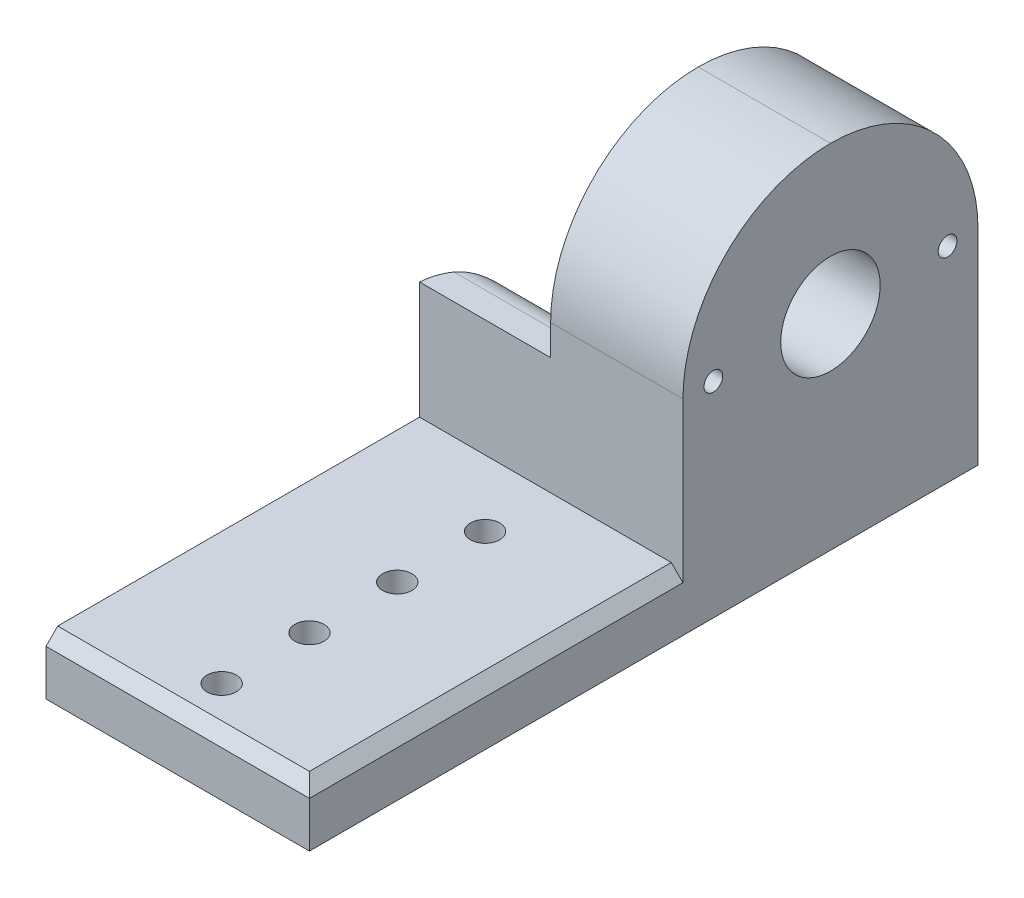
from build123d import *

# Parameters (mm, degrees)
SKETCH1_W           = 57.15
SKETCH1_H           = 145.034
BOSS_EXTRUDE1_DEPTH = 25.4
SKETCH4_R           = 3.175
CUT_EXTRUDE3_DEPTH  = 158.943482474
SKETCH7_W           = 28.702
SKETCH7_H           = 64.008
BOSS_EXTRUDE2_DEPTH = 76.454
FILLET1_R           = 32.004
SKETCH9_R           = 10.795
SKETCH9_R_2         = 2.032
CUT_EXTRUDE5_DEPTH  = 76.454
CUT_EXTRUDE7_DEPTH  = 12.954
CHAMFER1_SIZE       = 2.54
BOSS_EXTRUDE4_DEPTH = 28.448
FILLET3_R           = 6.35


# Some blends are built 0.0001 mm under size
with BuildPart() as part:
    # Sketch1 → Boss-Extrude1 (new body)
    with BuildSketch(Plane(origin=(0, 0, 0), x_dir=(1, 0, 0), z_dir=(0, 1, 0))):
        with Locations((28.575, 72.517)):
            Rectangle(SKETCH1_W, SKETCH1_H)
    extrude(amount=BOSS_EXTRUDE1_DEPTH)

    # Sketch4 → Cut-Extrude3 (cut, through all)
    with BuildSketch(Plane(origin=(0, 0, 0), x_dir=(-1, 0, 0), z_dir=(0, -1, 0))):
        with Locations(Location((-28.575, 9.525, 0), (0, 0, 90))):
            Circle(SKETCH4_R)
        with Locations(Location((-28.575, 28.575, 0), (0, 0, 90))):
            Circle(SKETCH4_R)
        with Locations(Location((-28.575, 47.625, 0), (0, 0, 90))):
            Circle(SKETCH4_R)
        with Locations(Location((-28.575, 66.675, 0), (0, 0, 90))):
            Circle(SKETCH4_R)
    extrude(amount=-CUT_EXTRUDE3_DEPTH, mode=Mode.SUBTRACT)

    # Sketch7 → Boss-Extrude2 (add)
    with BuildSketch(Plane.XZ):
        with Locations((42.799, -113.03)):
            Rectangle(SKETCH7_W, SKETCH7_H)
    extrude(amount=-BOSS_EXTRUDE2_DEPTH)

    # Fillet1
    fillet1_edges = [part.edges().sort_by_distance(p)[0] for p in [
        (42.799, 76.454, -145.034),
        (42.799, 76.454, -81.026),
    ]]
    fillet(fillet1_edges, radius=FILLET1_R - 0.0001)  # a hair under: the kernel refuses the full size

    # Sketch9 → Cut-Extrude5 (cut)
    with BuildSketch(Plane.ZY.offset(-28.448)):
        with Locations((-113.03, 44.45)):
            Circle(SKETCH9_R)
        with Locations((-138.43, 44.45)):
            Circle(SKETCH9_R_2)
        with Locations((-87.63, 44.45)):
            Circle(SKETCH9_R_2)
    extrude(amount=-CUT_EXTRUDE5_DEPTH, mode=Mode.SUBTRACT)

    # Sketch10 → Cut-Extrude7 (cut)
    with BuildSketch(Plane(origin=(0, 25.4, 0), x_dir=(1, 0, 0), z_dir=(0, 1, 0))):
        Polygon((28.448, 113.03), (28.448, 81.026), (57.15, 81.026), (57.15, 0), (50.8, 0), (0, 0), (0, 113.03), (0, 145.034), (28.448, 145.034), align=None)
    extrude(amount=-CUT_EXTRUDE7_DEPTH, mode=Mode.SUBTRACT)

    # Chamfer1
    chamfer1_edges = [part.edges().sort_by_distance(p)[0] for p in [
        (57.15, 12.446, -40.513),
        (28.575, 12.446, 0),
    ]]
    chamfer(chamfer1_edges, length=CHAMFER1_SIZE)

    # Sketch14 → Boss-Extrude4 (add)
    with BuildSketch(Plane.ZY.offset(-28.448)):
        Polygon((-113.637411412, 13.462), (-138.021411412, 37.846), (-145.034, 37.846), (-145.034, 12.446), (-81.026, 12.446), (-81.026, 37.846), (-89.253411412, 37.846), align=None)
    extrude(amount=BOSS_EXTRUDE4_DEPTH)

    # Fillet3
    # the kernel refuses this fillet: 6.35 mm, written as the material it takes off along each edge
    with BuildSketch(Plane(origin=(0, 49.071320151, -78.028091261), x_dir=(1, 0, 0), z_dir=(0, -0.707106781186549, -0.7071067811865461)), Plane(origin=(0, 13.462, -113.637411412), x_dir=(1, 0, 0), z_dir=(0, 0.7071067811865438, -0.7071067811865512))) as fillet3_piece_1:
        with BuildLine():
            CenterArc((FILLET3_R, FILLET3_R), FILLET3_R, 180, 90)
            Line((0, FILLET3_R), (0, 0))
            Line((0, 0), (FILLET3_R, 0))
        make_face()
    extrude(amount=50.359183505, mode=Mode.SUBTRACT)
    with BuildSketch(Plane(origin=(28.448, 37.846, -89.253411412), x_dir=(0, -0.7071067811865475, -0.7071067811865475), z_dir=(-1, 0, 0)), Plane(origin=(28.448, 37.846, -138.021411412), x_dir=(0, 0, -1), z_dir=(-1, 0, 0))) as fillet3_piece_2:
        with BuildLine():
            CenterArc((FILLET3_R * 0.414213562373, FILLET3_R), FILLET3_R, 225, 45)
            Line((-FILLET3_R * 0.292893218813, FILLET3_R * 0.292893218813), (0, 0))
            Line((0, 0), (FILLET3_R * 0.414213562373, 0))
        make_face()
    extrude(amount=35.023640303, mode=Mode.SUBTRACT)
    with BuildSketch(Plane(origin=(0, 2.236679849, -102.412091261), x_dir=(1, 0, 0), z_dir=(0, 0.7071067811865438, -0.7071067811865512))) as fillet3_piece_3a_section:
        with BuildLine():
            CenterArc((FILLET3_R, FILLET3_R), FILLET3_R, 180, 90)
            Line((0, FILLET3_R), (0, 0))
            Line((0, 0), (FILLET3_R, 0))
        make_face()
    fillet3_piece_3a = extrude(amount=66.234183505, mode=Mode.PRIVATE)
    fillet3_piece_3a = split(fillet3_piece_3a, bisect_by=Plane(origin=(1.437608976, 12.445456945, -114.653954468), z_dir=(0, -0.7071067811865461, 0.707106781186549)), keep=Keep.TOP, mode=Mode.PRIVATE)
    with BuildSketch(Plane(origin=(0, 49.071320151, -78.028091261), x_dir=(1, 0, 0), z_dir=(0, -0.707106781186549, -0.7071067811865461))) as fillet3_piece_3b_section:
        with BuildLine():
            CenterArc((FILLET3_R, FILLET3_R), FILLET3_R, 180, 90)
            Line((0, FILLET3_R), (0, 0))
            Line((0, 0), (FILLET3_R, 0))
        make_face()
    fillet3_piece_3b = extrude(amount=66.234183505, mode=Mode.PRIVATE)
    fillet3_piece_3b = split(fillet3_piece_3b, bisect_by=Plane(origin=(1.437608976, 12.445456945, -112.620868357), z_dir=(0, -0.7071067811865512, -0.7071067811865438)), keep=Keep.TOP, mode=Mode.PRIVATE)
    fillet3_piece_3 = fillet3_piece_3a & fillet3_piece_3b
    add(fillet3_piece_3, mode=Mode.SUBTRACT)


solid = part.part
